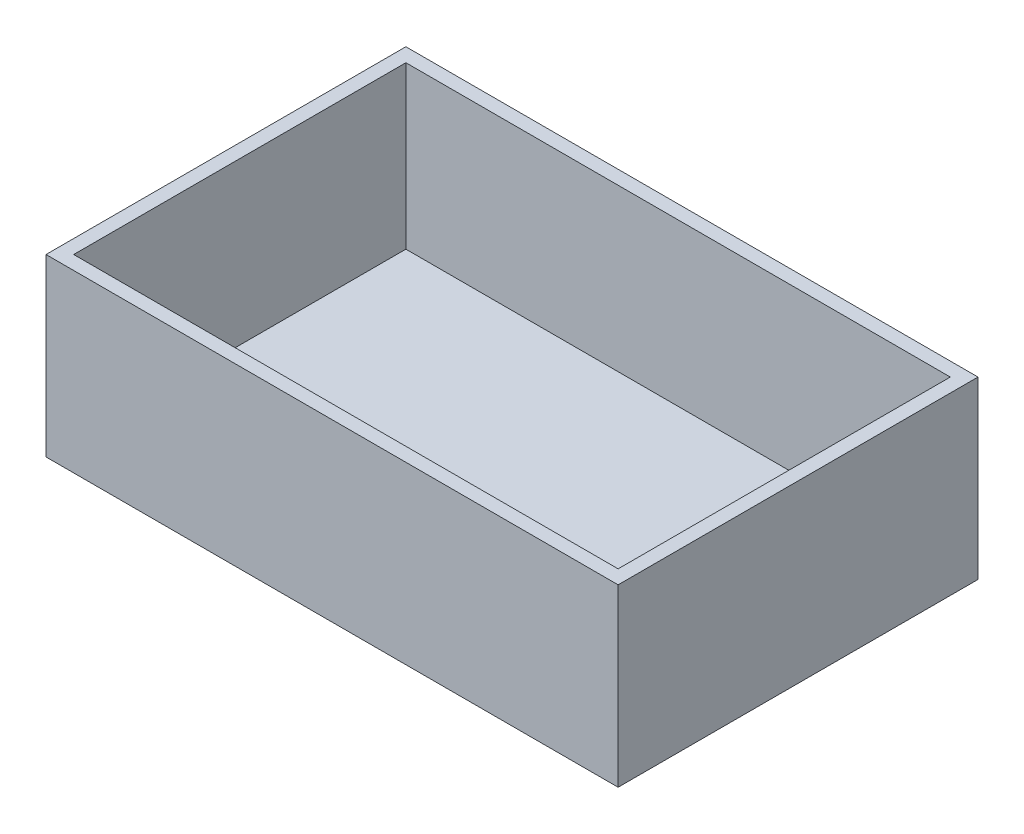
from build123d import *

# Parameters (mm, degrees)
SKETCH1_W           = 787.4
SKETCH1_H           = 495.3
BOSS_EXTRUDE1_DEPTH = 241.3
SHELL1_T            = -19.05


with BuildPart() as part:
    # Sketch1 → Boss-Extrude1 (new body)
    with BuildSketch(Plane(origin=(0, 0, 0), x_dir=(1, 0, 0), z_dir=(0, 1, 0))):
        with Locations((393.7, 247.65)):
            Rectangle(SKETCH1_W, SKETCH1_H)
    extrude(amount=BOSS_EXTRUDE1_DEPTH)

    # Shell1
    shell1_openings = [part.faces().sort_by_distance(p)[0] for p in [
        (393.7, 241.3, -247.65),
    ]]
    offset(amount=SHELL1_T, openings=shell1_openings, kind=Kind.INTERSECTION)


solid = part.part
